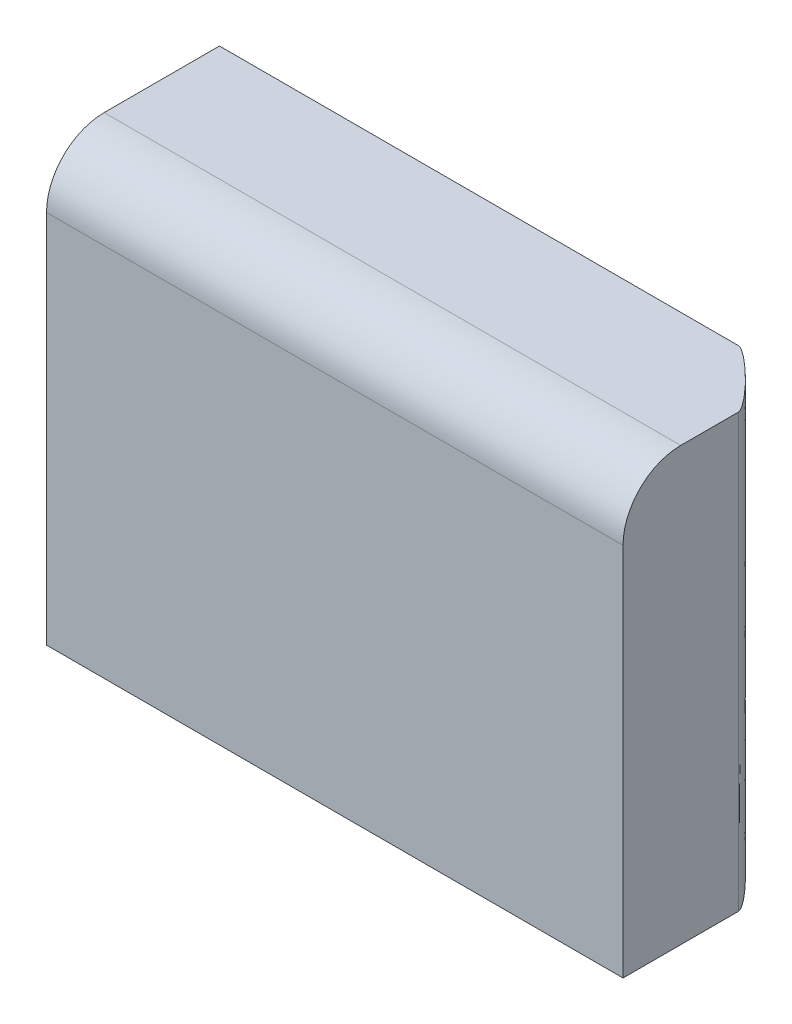
from build123d import *

# Parameters (mm, degrees)
SKETCH_1_W      = 20
SKETCH_1_H      = 15
EXTRUDE_1_DEPTH = 3
FILLET_1_R      = 2
FILLET_3_SIZE   = 2


with BuildPart() as part:
    # 草图1 → 凸台-拉伸1 (new, symmetric)
    with BuildSketch(Plane.XY):
        Rectangle(SKETCH_1_W, SKETCH_1_H)
    extrude(amount=EXTRUDE_1_DEPTH, both=True)

    # 圆角1
    fillet_1_edges = [part.edges().sort_by_distance(p)[0] for p in [
        (0, 7.5, 3),
    ]]
    fillet(fillet_1_edges, radius=FILLET_1_R)

    # 圆角3
    # a fillet whose section is not a circle: 2 mm, written as the material it takes off along each edge
    with BuildSketch(Plane(origin=(10, 12.5, -3), x_dir=(-1, 0, 0), z_dir=(0, -1, 0))) as fillet_3_piece_1:
        with BuildLine():
            Bezier((FILLET_3_SIZE, 0), (0, 0), (0, -FILLET_3_SIZE), weights=[1, 0.141421356, 1])
            Line((0, -FILLET_3_SIZE), (0, 0))
            Line((0, 0), (FILLET_3_SIZE, 0))
        make_face()
    extrude(amount=25, mode=Mode.SUBTRACT)


solid = part.part
